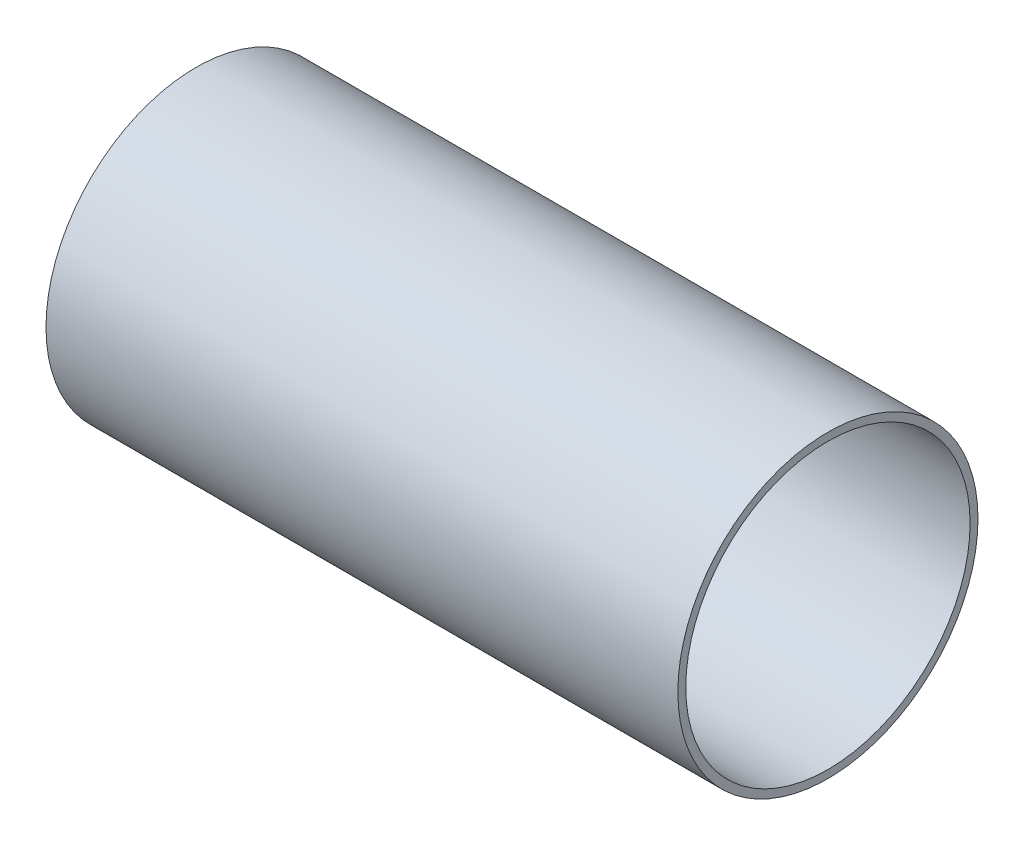
from build123d import *

# Parameters (mm, degrees)
SKETCH1_R           = 60.325
SKETCH1_R_2         = 57.15
BOSS_EXTRUDE1_DEPTH = 254


with BuildPart() as part:
    # Sketch1 → Boss-Extrude1 (new body)
    with BuildSketch(Plane(origin=(0, 0, 0), x_dir=(0, 0, -1), z_dir=(1, 0, 0))):
        Circle(SKETCH1_R)
        Circle(SKETCH1_R_2, mode=Mode.SUBTRACT)
    extrude(amount=BOSS_EXTRUDE1_DEPTH)


solid = part.part
